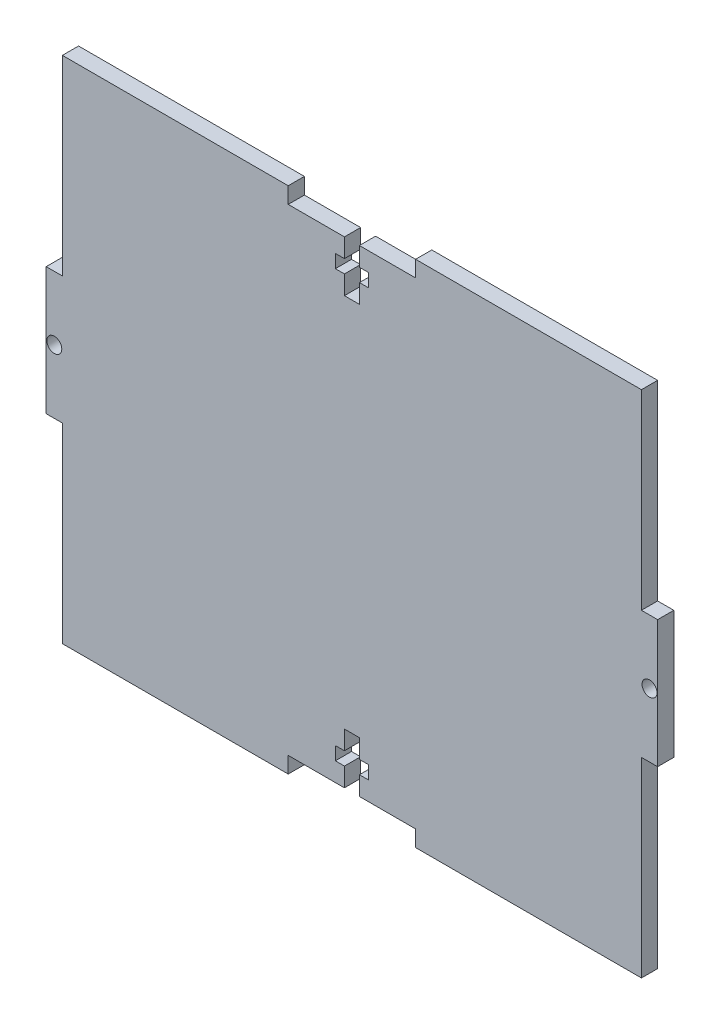
from build123d import *

# Parameters (mm, degrees)
SKETCH1_R           = 1.47
BOSS_EXTRUDE1_DEPTH = 1.5875


with BuildPart() as part:
    # Sketch1 → Boss-Extrude1 (new, symmetric)
    with BuildSketch(Plane.XY):
        Polygon((-12.5, 50), (-56.825, 50), (-56.825, 12.5), (-60, 12.5), (-60, -12.5), (-56.825, -12.5), (-56.825, -50), (-12.5, -50), (-12.5, -46.825), (-1.47, -46.825), (-1.47, -43.125), (-3.25, -43.125), (-3.25, -40.525), (-1.47, -40.525), (-1.47, -36.825), (1.47, -36.825), (1.47, -40.525), (3.25, -40.525), (3.25, -43.125), (1.47, -43.125), (1.47, -46.825), (12.5, -46.825), (12.5, -50), (56.825, -50), (56.825, -12.5), (60, -12.5), (60, 12.5), (56.825, 12.5), (56.825, 50), (12.5, 50), (12.5, 46.825), (1.47, 46.825), (1.47, 43.125), (3.25, 43.125), (3.25, 40.525), (1.47, 40.525), (1.47, 36.825), (-1.47, 36.825), (-1.47, 40.525), (-3.25, 40.525), (-3.25, 43.125), (-1.47, 43.125), (-1.47, 46.825), (-12.5, 46.825), align=None)
        with Locations((58.4125, 0)):
            Circle(SKETCH1_R, mode=Mode.SUBTRACT)
        with Locations((-58.4125, 0)):
            Circle(SKETCH1_R, mode=Mode.SUBTRACT)
    extrude(amount=BOSS_EXTRUDE1_DEPTH, both=True)


solid = part.part
